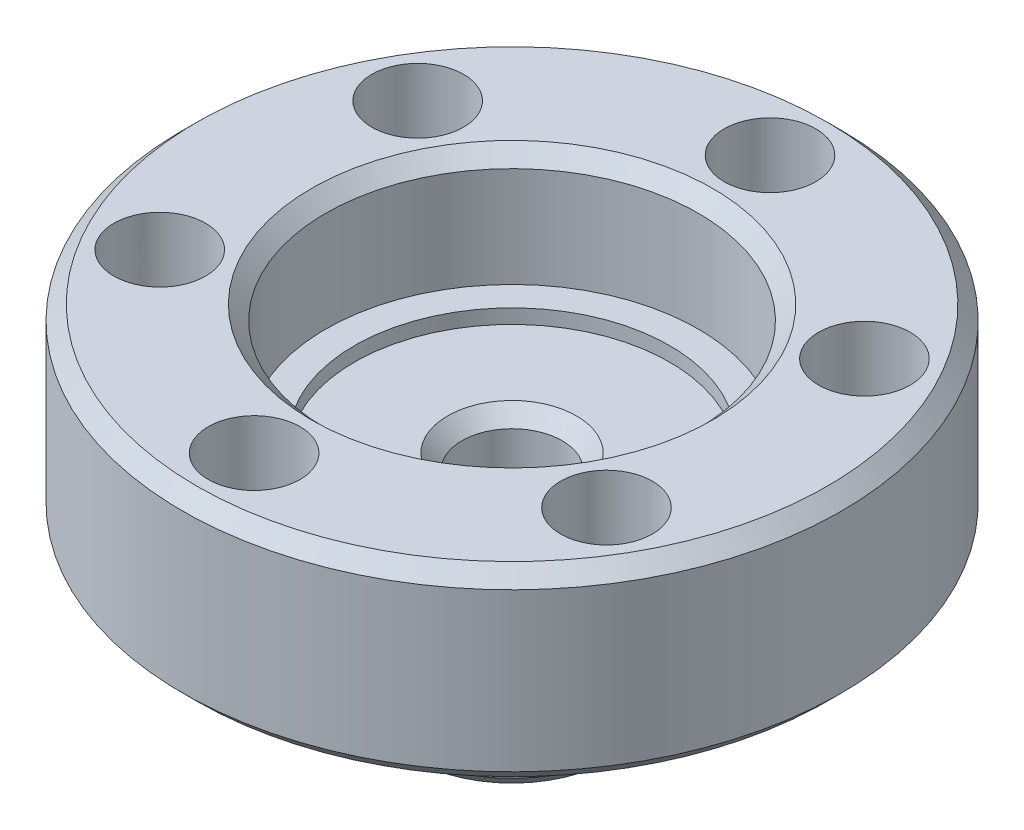
from build123d import *

# Parameters (mm, degrees)
SKETCH1_R           = 11.5
BOSS_EXTRUDE1_DEPTH = 6.5
SKETCH2_R           = 5
BOSS_EXTRUDE2_DEPTH = 0.5
SKETCH3_R           = 4
BOSS_EXTRUDE3_DEPTH = 5
SKETCH4_R           = 6.5
CUT_EXTRUDE1_DEPTH  = 4
SKETCH5_R           = 5.5
CUT_EXTRUDE2_DEPTH  = 0.5
SKETCH6_R           = 1.75
CUT_EXTRUDE3_DEPTH  = 7.5
SKETCH7_R           = 1.6
CUT_EXTRUDE4_DEPTH  = 6.5
SKETCH8_R           = 2
CUT_EXTRUDE5_DEPTH  = 4
CIRPATTERN1_COUNT   = 6
CHAMFER2_SIZE       = 0.5


with BuildPart() as part:
    # Sketch1 → Boss-Extrude1 (new body)
    with BuildSketch(Plane(origin=(0, 0, 0), x_dir=(1, 0, 0), z_dir=(0, 1, 0))):
        with Locations(Location((0, 0, 0), (0, 0, 90))):
            Circle(SKETCH1_R)
    extrude(amount=BOSS_EXTRUDE1_DEPTH)

    # Sketch2 → Boss-Extrude2 (add)
    with BuildSketch(Plane.XZ):
        with Locations(Location((0, 0, 0), (0, 0, 270))):
            Circle(SKETCH2_R)
    extrude(amount=BOSS_EXTRUDE2_DEPTH)

    # Sketch3 → Boss-Extrude3 (add)
    with BuildSketch(Plane.XZ.offset(0.5)):
        with Locations(Location((0, 0, 0), (0, 0, 270))):
            Circle(SKETCH3_R)
    extrude(amount=BOSS_EXTRUDE3_DEPTH)

    # Sketch4 → Cut-Extrude1 (cut)
    with BuildSketch(Plane(origin=(0, 6.5, 0), x_dir=(1, 0, 0), z_dir=(0, 1, 0))):
        with Locations(Location((0, 0, 0), (0, 0, 270))):
            Circle(SKETCH4_R)
    extrude(amount=-CUT_EXTRUDE1_DEPTH, mode=Mode.SUBTRACT)

    # Sketch5 → Cut-Extrude2 (cut)
    with BuildSketch(Plane(origin=(0, 2.5, 0), x_dir=(1, 0, 0), z_dir=(0, 1, 0))):
        with Locations(Location((0, 0, 0), (0, 0, 270))):
            Circle(SKETCH5_R)
    extrude(amount=-CUT_EXTRUDE2_DEPTH, mode=Mode.SUBTRACT)

    # Sketch6 → Cut-Extrude3 (cut)
    with BuildSketch(Plane(origin=(0, 2, 0), x_dir=(1, 0, 0), z_dir=(0, 1, 0))):
        with Locations(Location((0, 0, 0), (0, 0, 270))):
            Circle(SKETCH6_R)
    extrude(amount=-CUT_EXTRUDE3_DEPTH, mode=Mode.SUBTRACT)

    # Sketch7 → Cut-Extrude4 (cut)
    with BuildSketch(Plane(origin=(0, 6.5, 0), x_dir=(1, 0, 0), z_dir=(0, 1, 0))):
        with Locations(Location((0, 9, 0), (0, 0, 270))):
            Circle(SKETCH7_R)
    cut_extrude4 = extrude(amount=-CUT_EXTRUDE4_DEPTH, mode=Mode.SUBTRACT)

    # Sketch8 → Cut-Extrude5 (cut)
    with BuildSketch(Plane.XZ):
        with Locations(Location((0, -9, 0), (0, 0, 270))):
            Circle(SKETCH8_R)
    cut_extrude5 = extrude(amount=-CUT_EXTRUDE5_DEPTH, mode=Mode.SUBTRACT)

    # CirPattern1: Cut-Extrude4, Cut-Extrude5 ×6 about axis
    cirpattern1_axis = Axis((0, 0, 0), (0, 1, 0))
    add([cut_extrude4.rotate(cirpattern1_axis, i * 360 / CIRPATTERN1_COUNT) for i in range(1, CIRPATTERN1_COUNT)], mode=Mode.SUBTRACT)
    add([cut_extrude5.rotate(cirpattern1_axis, i * 360 / CIRPATTERN1_COUNT) for i in range(1, CIRPATTERN1_COUNT)], mode=Mode.SUBTRACT)

    # Chamfer2
    chamfer2_edges = [part.edges().sort_by_distance(p)[0] for p in [
        (0, -5.5, 4),
        (0, 6.5, -6.5),
        (0, 0, 11.5),
        (0, 2, -1.75),
        (0, -5.5, -1.75),
        (0, 6.5, 11.5),
    ]]
    chamfer(chamfer2_edges, length=CHAMFER2_SIZE - 0.0001)  # a hair under: the kernel refuses the full size


solid = part.part
